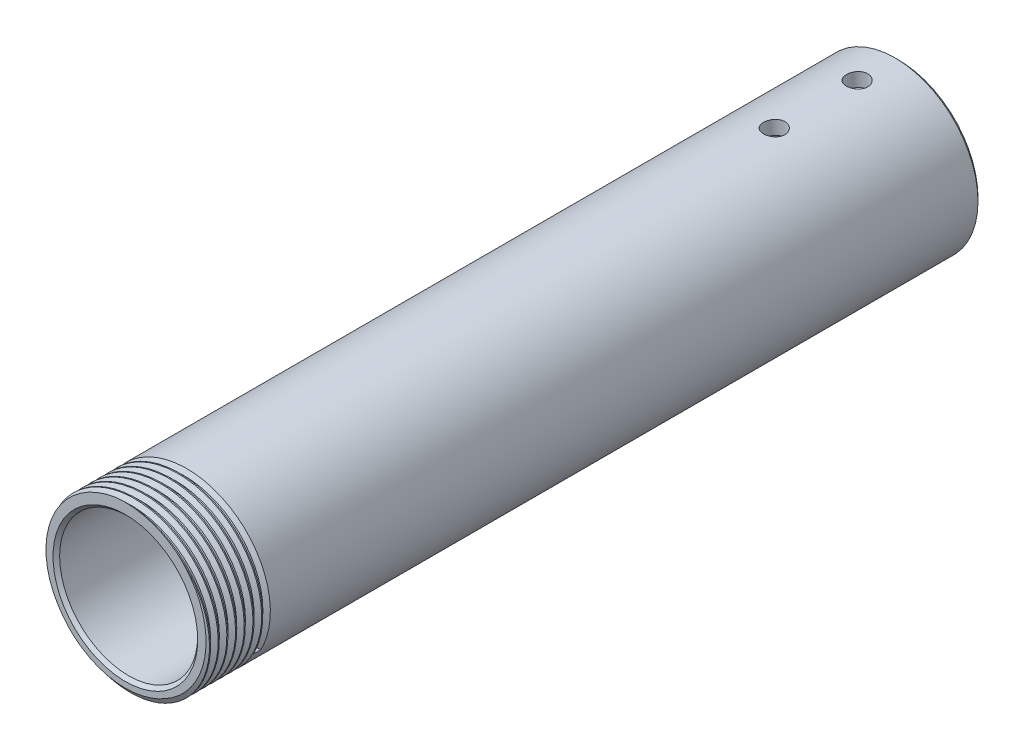
from build123d import *

# Parameters (mm, degrees)
SKETCH1_R                       = 19.05
SKETCH1_R_2                     = 15.875
BOSS_EXTRUDE1_DEPTH             = 177.8
F_8_CLEARANCE_HOLE1_D           = 4.9149
F_8_CLEARANCE_HOLE2_REACH       = 184.831
F_8_CLEARANCE_HOLE2_BORE_R      = 2.45745
F_1_2_0_5_DIAMETER_HOLE1_REACH  = 184.831
F_1_2_0_5_DIAMETER_HOLE1_BORE_R = 6.35
M36_2_0_X_12_7_THREAD_PITCH     = 2
CHAMFER1_SIZE                   = 0.762


with BuildPart() as part:
    # Sketch1 → Boss-Extrude1 (new body)
    with BuildSketch(Plane.XY):
        Circle(SKETCH1_R)
        Circle(SKETCH1_R_2, mode=Mode.SUBTRACT)
    extrude(amount=BOSS_EXTRUDE1_DEPTH)

    # #8 Clearance Hole1 (through all)
    with Locations(Plane(origin=(0, 19.05, 0), x_dir=(1, 0, 0), z_dir=(0, 1, 0))):
        with Locations((0, -9.525), (0, -28.575)):
            Hole(F_8_CLEARANCE_HOLE1_D / 2)

    # #8 Clearance Hole2 bore → #8 Clearance Hole2 (cut, up to next)
    with BuildSketch(Plane(origin=(0, -19.05, 0), x_dir=(-1, 0, 0), z_dir=(0, -1, 0)), mode=Mode.PRIVATE) as f_8_clearance_hole2_sk1:
        with Locations((0, -107.15625)):
            Circle(F_8_CLEARANCE_HOLE2_BORE_R)
    f_8_clearance_hole2_tool1 = extrude(f_8_clearance_hole2_sk1.sketch, amount=-F_8_CLEARANCE_HOLE2_REACH, mode=Mode.PRIVATE) & part.part
    # #8 Clearance Hole2 bore → #8 Clearance Hole2 (cut, up to next)
    with BuildSketch(Plane(origin=(0, -19.05, 0), x_dir=(-1, 0, 0), z_dir=(0, -1, 0)), mode=Mode.PRIVATE) as f_8_clearance_hole2_sk2:
        with Locations((0, -69.05625)):
            Circle(F_8_CLEARANCE_HOLE2_BORE_R)
    f_8_clearance_hole2_tool2 = extrude(f_8_clearance_hole2_sk2.sketch, amount=-F_8_CLEARANCE_HOLE2_REACH, mode=Mode.PRIVATE) & part.part
    add(f_8_clearance_hole2_tool1.solids().sort_by_distance((0, -19.05, 107.15625))[0], mode=Mode.SUBTRACT)
    add(f_8_clearance_hole2_tool2.solids().sort_by_distance((0, -19.05, 69.05625))[0], mode=Mode.SUBTRACT)

    # 1/2 (0.5) Diameter Hole1 bore → 1/2 (0.5) Diameter Hole1 (cut, up to next)
    with BuildSketch(Plane(origin=(0, -19.05, 0), x_dir=(-1, 0, 0), z_dir=(0, -1, 0)), mode=Mode.PRIVATE) as f_1_2_0_5_diameter_hole1_sk1:
        with Locations((0, -88.10625)):
            Circle(F_1_2_0_5_DIAMETER_HOLE1_BORE_R)
    f_1_2_0_5_diameter_hole1_tool1 = extrude(f_1_2_0_5_diameter_hole1_sk1.sketch, amount=-F_1_2_0_5_DIAMETER_HOLE1_REACH, mode=Mode.PRIVATE) & part.part
    add(f_1_2_0_5_diameter_hole1_tool1.solids().sort_by_distance((0, -19.05, 88.10625))[0], mode=Mode.SUBTRACT)

    # M36-2.0 X 12.7 Thread: arcs per turn and ends read off the stored shape
    # M36-2.0 X 12.7 Thread: the profile of Thread Profile1 profile screwed along a right-hand helix through 7.58 turns, 10 arcs to a turn; built about Z, then put on its axis
    m36_2_0_x_12_7_thread_z = Axis((0, 0, 0), (0, 0, 1))
    m36_2_0_x_12_7_thread_corners = [(19.0503, 0, -0.000173205), (19.0503, 0, 1.7501732), (17.96746825, 0, 1.124999997), (17.96746825, 0, 0.624999997)]
    with BuildLine(mode=Mode.PRIVATE) as m36_2_0_x_12_7_thread_profile:
        Line(m36_2_0_x_12_7_thread_corners[0], m36_2_0_x_12_7_thread_corners[1])
        Line(m36_2_0_x_12_7_thread_corners[1], m36_2_0_x_12_7_thread_corners[2])
        Line(m36_2_0_x_12_7_thread_corners[2], m36_2_0_x_12_7_thread_corners[3])
        Line(m36_2_0_x_12_7_thread_corners[3], m36_2_0_x_12_7_thread_corners[0])
    m36_2_0_x_12_7_thread_cap = Face(m36_2_0_x_12_7_thread_profile.wire())
    m36_2_0_x_12_7_thread_turn_angles = [0, 18, 36, 54, 72, 90, 108, 126, 144, 162, 180, 198, 216, 234, 252, 270, 288, 306, 324, 342, 360]
    m36_2_0_x_12_7_thread_turn_weights = [1, 0.9510565162951535, 1, 0.9510565162951535, 1, 0.9510565162951535, 1, 0.9510565162951535, 1, 0.9510565162951535, 1, 0.9510565162951535, 1, 0.9510565162951535, 1, 0.9510565162951535, 1, 0.9510565162951535, 1, 0.9510565162951535, 1]
    m36_2_0_x_12_7_thread_turn_rails = [Edge.make_bspline([Vector(p[0], p[1], 0).rotate(m36_2_0_x_12_7_thread_z, m36_2_0_x_12_7_thread_turn_angles[k]) / m36_2_0_x_12_7_thread_turn_weights[k] + Vector(0, 0, p[2] + M36_2_0_X_12_7_THREAD_PITCH * m36_2_0_x_12_7_thread_turn_angles[k] / 360) for k in range(21)], [0, 0, 0, 1, 1, 2, 2, 3, 3, 4, 4, 5, 5, 6, 6, 7, 7, 8, 8, 9, 9, 10, 10, 10], 2, m36_2_0_x_12_7_thread_turn_weights) for p in m36_2_0_x_12_7_thread_corners]
    m36_2_0_x_12_7_thread_turn_sides = [Face.make_surface_from_curves(m36_2_0_x_12_7_thread_turn_rails[p[0]], m36_2_0_x_12_7_thread_turn_rails[p[1]]) for p in [(0, 1), (1, 2), (2, 3), (3, 0)]]
    m36_2_0_x_12_7_thread_last_angles = [2520, 2538, 2556, 2574, 2592, 2610, 2628, 2646, 2664, 2682, 2700, 2714.4, 2728.8]
    m36_2_0_x_12_7_thread_last_weights = [1, 0.9510565162951535, 1, 0.9510565162951535, 1, 0.9510565162951535, 1, 0.9510565162951535, 1, 0.9510565162951535, 1, 0.9685831611286307, 1]
    m36_2_0_x_12_7_thread_last_rails = [Edge.make_bspline([Vector(p[0], p[1], 0).rotate(m36_2_0_x_12_7_thread_z, m36_2_0_x_12_7_thread_last_angles[k]) / m36_2_0_x_12_7_thread_last_weights[k] + Vector(0, 0, p[2] + M36_2_0_X_12_7_THREAD_PITCH * m36_2_0_x_12_7_thread_last_angles[k] / 360) for k in range(13)], [0, 0, 0, 1, 1, 2, 2, 3, 3, 4, 4, 5, 5, 6, 6, 6], 2, m36_2_0_x_12_7_thread_last_weights) for p in m36_2_0_x_12_7_thread_corners]
    m36_2_0_x_12_7_thread_last_sides = [Face.make_surface_from_curves(m36_2_0_x_12_7_thread_last_rails[p[0]], m36_2_0_x_12_7_thread_last_rails[p[1]]) for p in [(0, 1), (1, 2), (2, 3), (3, 0)]]
    m36_2_0_x_12_7_thread = Plane(origin=(0, 0, 180.259999906), x_dir=(-1, 0, 0), z_dir=(0, 0, -1)) * Solid(Shell([*[p.moved(Location((0, 0, M36_2_0_X_12_7_THREAD_PITCH * i))) for i in range(7) for p in m36_2_0_x_12_7_thread_turn_sides], *m36_2_0_x_12_7_thread_last_sides, m36_2_0_x_12_7_thread_cap, m36_2_0_x_12_7_thread_cap.rotate(m36_2_0_x_12_7_thread_z, 2728.8).moved(Location((0, 0, M36_2_0_X_12_7_THREAD_PITCH * 2728.8 / 360)))]))
    add(m36_2_0_x_12_7_thread, mode=Mode.SUBTRACT)

    # Chamfer1
    chamfer1_edges = [part.edges().sort_by_distance(p)[0] for p in [
        (-19.05, 0, 0),
        (-15.875, 0, 0),
        (-15.875, 0, 177.8),
    ]]
    chamfer(chamfer1_edges, length=CHAMFER1_SIZE)


solid = part.part
